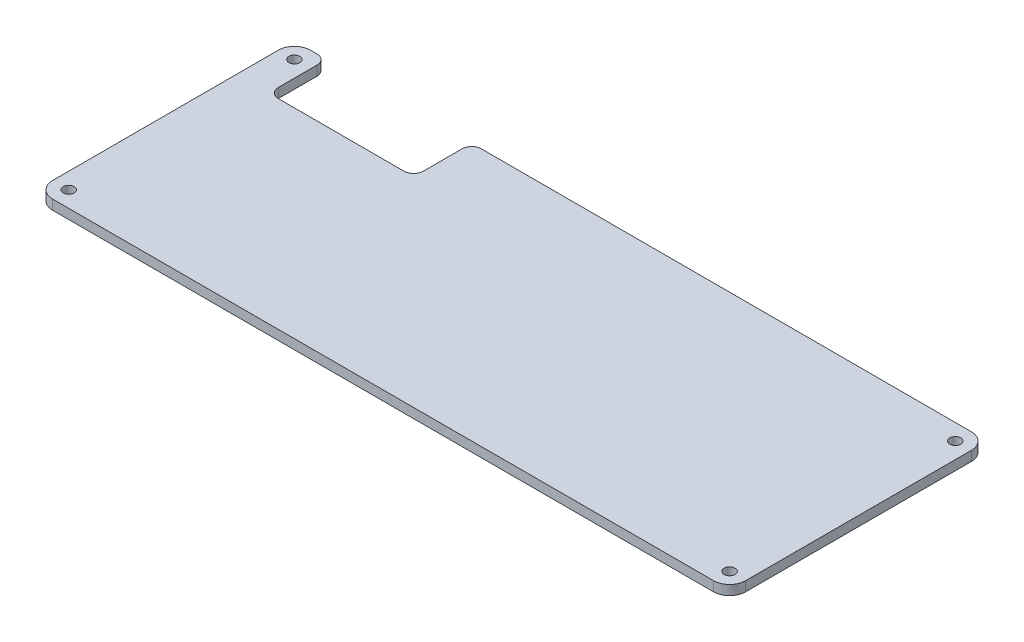
from build123d import *

# Parameters (mm, degrees)
ESQUISSE1_W             = 215
ESQUISSE1_H             = 80
BOSS_EXTRU_1_DEPTH      = 3
CONG_1_R                = 5
ESQUISSE2_R             = 1
ESQUISSE2_W             = 45
ESQUISSE2_H             = 18
ENL_V_MAT_EXTRU_1_DEPTH = 230.421010372
D_GAGEMENT_M31_D        = 3.4
D_GAGEMENT_M31_DEPTH    = 10
D_GAGEMENT_M31_TIP      = 1.021463052
CONG_2_R                = 3


with BuildPart() as part:
    # Esquisse1 → Boss.-Extru.1 (new body)
    with BuildSketch(Plane(origin=(0, 0, 0), x_dir=(1, 0, 0), z_dir=(0, 1, 0))):
        with Locations((107.5, 40)):
            Rectangle(ESQUISSE1_W, ESQUISSE1_H)
    extrude(amount=BOSS_EXTRU_1_DEPTH)

    # Congé1
    cong_1_edges = [part.edges().sort_by_distance(p)[0] for p in [
        (0, 1.5, -80),
        (0, 1.5, 0),
        (215, 1.5, -80),
        (215, 1.5, 0),
    ]]
    fillet(cong_1_edges, radius=CONG_1_R)

    # Esquisse2 → Enlèv. mat.-Extru.1 (cut, through all)
    with BuildSketch(Plane(origin=(0, 3, 0), x_dir=(1, 0, 0), z_dir=(0, 1, 0))):
        with Locations((5, 75)):
            Circle(ESQUISSE2_R)
        with Locations((210, 75)):
            Circle(ESQUISSE2_R)
        with Locations((210, 5)):
            Circle(ESQUISSE2_R)
        with Locations((5, 5)):
            Circle(ESQUISSE2_R)
        with Locations((32.5, 71)):
            Rectangle(ESQUISSE2_W, ESQUISSE2_H)
    extrude(amount=-ENL_V_MAT_EXTRU_1_DEPTH, mode=Mode.SUBTRACT)

    # Dégagement M31
    with Locations(Plane(origin=(0, 3, 0), x_dir=(1, 0, 0), z_dir=(0, 1, 0))):
        with Locations((210, 5), (5, 5), (5, 75), (210, 75)):
            Hole(D_GAGEMENT_M31_D / 2, depth=D_GAGEMENT_M31_DEPTH)
            with Locations((0, 0, -(D_GAGEMENT_M31_DEPTH + D_GAGEMENT_M31_TIP / 2))):  # 118° drill point
                Cone(0, D_GAGEMENT_M31_D / 2, D_GAGEMENT_M31_TIP, mode=Mode.SUBTRACT)

    # Congé2
    cong_2_edges = [part.edges().sort_by_distance(p)[0] for p in [
        (55, 1.5, -62),
        (55, 1.5, -80),
        (10, 1.5, -80),
        (10, 1.5, -62),
    ]]
    fillet(cong_2_edges, radius=CONG_2_R)


solid = part.part
